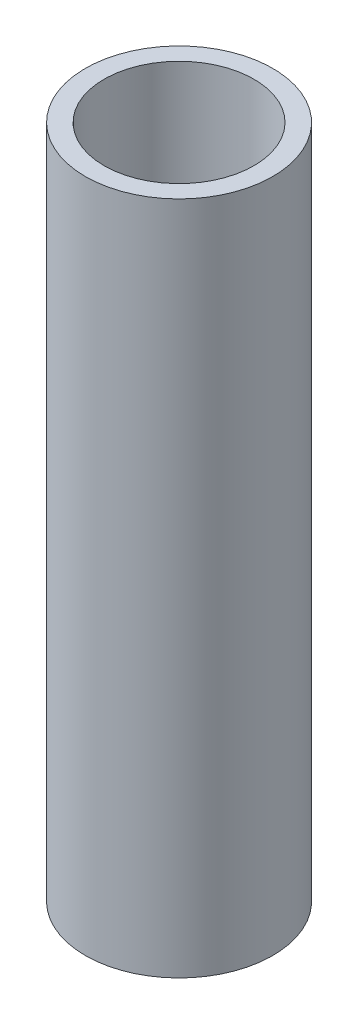
from build123d import *

# Parameters (mm, degrees)
SKETCH1_R           = 15.875
SKETCH1_R_2         = 12.7
BOSS_EXTRUDE1_DEPTH = 57.15


with BuildPart() as part:
    # Sketch1 → Boss-Extrude1 (new, symmetric)
    with BuildSketch(Plane(origin=(0, 0, 0), x_dir=(1, 0, 0), z_dir=(0, 1, 0))):
        Circle(SKETCH1_R)
        Circle(SKETCH1_R_2, mode=Mode.SUBTRACT)
    extrude(amount=BOSS_EXTRUDE1_DEPTH, both=True)


solid = part.part
